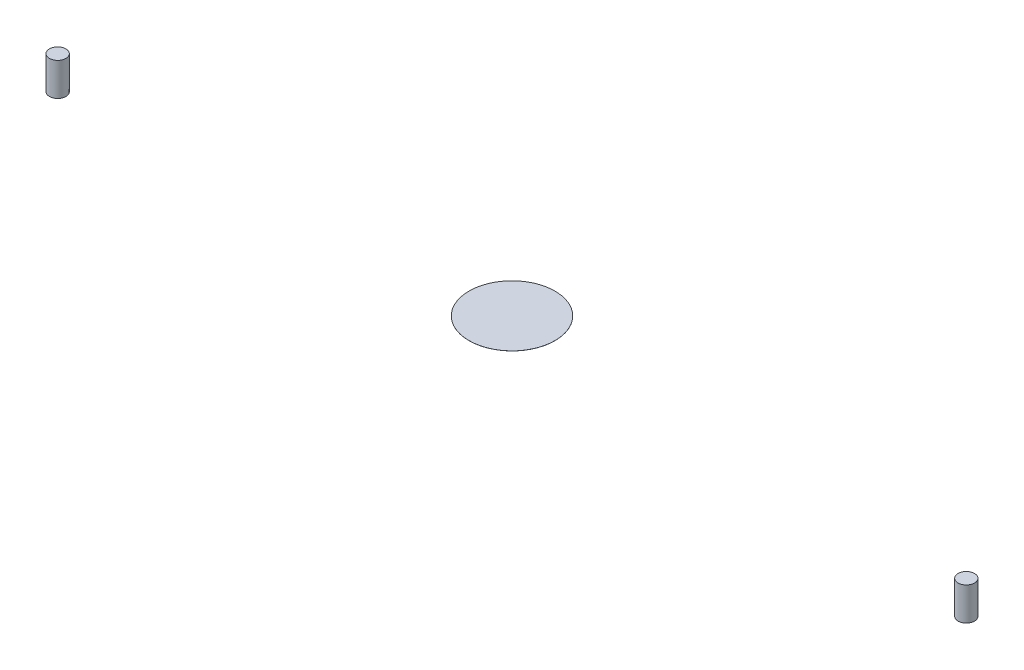
from build123d import *

# Parameters (mm, degrees)
SKETCH3_R           = 5200
BOSS_EXTRUDE2_DEPTH = 10
SKETCH7_R           = 999.999409007
BOSS_EXTRUDE3_DEPTH = 4000
SKETCH8_R           = 1000.000208638
BOSS_EXTRUDE4_DEPTH = 4000


# Read off the part's stored shape, not the designer's step: Surface-Imported1
with BuildPart() as part:
    # Sketch3 → Boss-Extrude2 (new body)
    with BuildSketch(Plane(origin=(0, 4000, 0), x_dir=(1, 0, 0), z_dir=(0, 1, 0))):
        with Locations(Location((0, 0, 0), (0, 0, 270))):
            Circle(SKETCH3_R)
    extrude(amount=BOSS_EXTRUDE2_DEPTH)


with BuildPart() as body_2:
    # Sketch7 → Boss-Extrude3 (new body)
    with BuildSketch(Plane(origin=(0, 4000, 0), x_dir=(1, 0, 0), z_dir=(0, 1, 0))):
        with Locations(Location((54999.999409007, -0.000796797, 0), (0, 0, 270))):
            Circle(SKETCH7_R)
    extrude(amount=-BOSS_EXTRUDE3_DEPTH)


with BuildPart() as body_3:
    # Sketch8 → Boss-Extrude4 (new body)
    with BuildSketch(Plane(origin=(0, 4000, 0), x_dir=(1, 0, 0), z_dir=(0, 1, 0))):
        with Locations(Location((-55000.000527864, -0.000231158, 0), (0, 0, 270))):
            Circle(SKETCH8_R)
    extrude(amount=-BOSS_EXTRUDE4_DEPTH)


solid = Compound([part.part, body_2.part, body_3.part])
